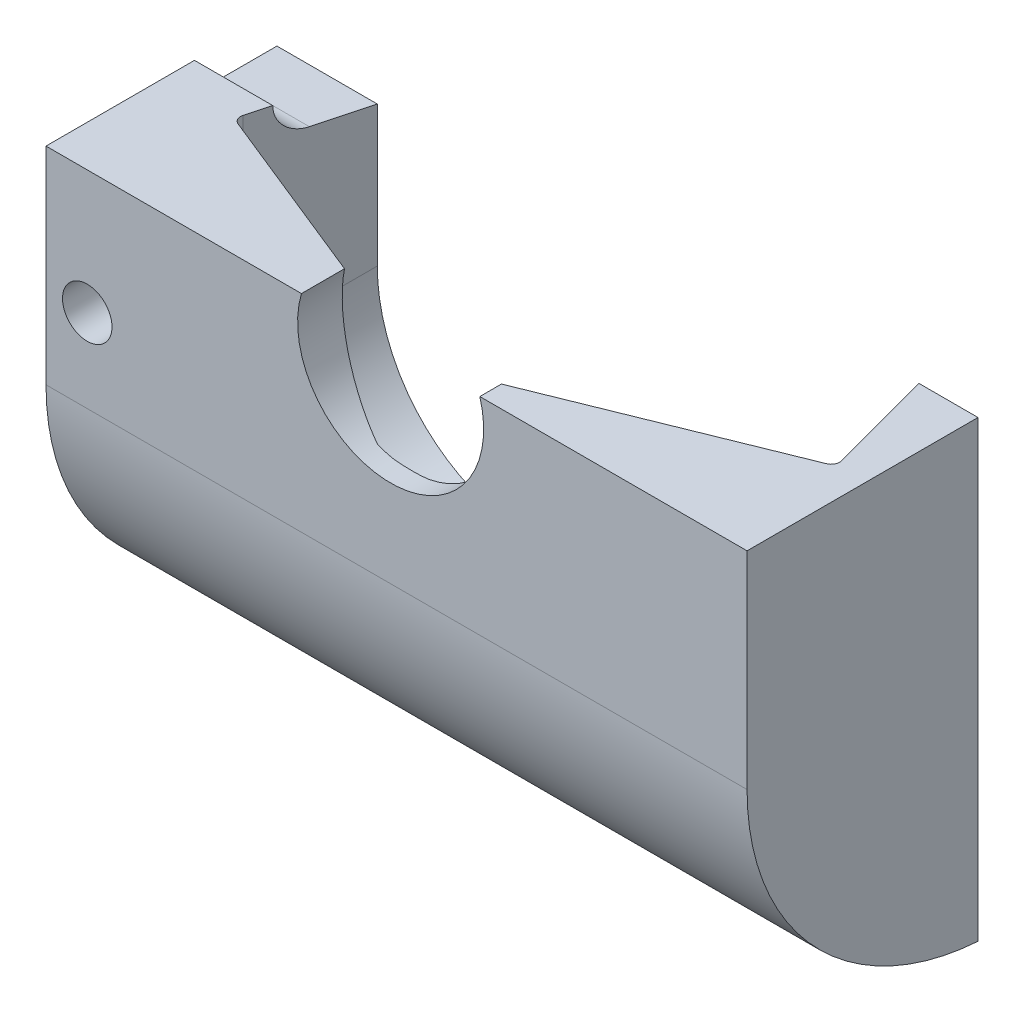
from build123d import *

# Parameters (mm, degrees)
SKETCH1_W           = 90
SKETCH1_H           = 110
BOSS_EXTRUDE1_DEPTH = 28
FILLET2_R           = 30
SKETCH3_R           = 1.5
CUT_EXTRUDE1_DEPTH  = 145.858551698
SKETCH4_R           = 3
CUT_EXTRUDE4_DEPTH  = 26
CUT_EXTRUDE5_START  = -13.7
SKETCH5_W           = 73
SKETCH5_H           = 87
CUT_EXTRUDE5_DEPTH  = 13.7
CUT_EXTRUDE5_TAPER  = 15
SKETCH8_W           = 73
SKETCH8_H           = 87
CUT_EXTRUDE8_DEPTH  = 11.8
CUT_EXTRUDE8_DRAFT  = -68
CUT_EXTRUDE9_START  = 30
SKETCH9_R           = 11.28
CUT_EXTRUDE9_DEPTH  = 61.8
FILLET19_R          = 20
SKETCH13_W          = 90
SKETCH13_H          = 55
CUT_EXTRUDE10_DEPTH = 145.858551855
CUT_EXTRUDE12_REACH = 111.128
SKETCH16_W          = 5
SKETCH16_H          = 55
CUT_EXTRUDE13_DEPTH = 110.128364941
FILLET20_R          = 1


with BuildPart() as part:
    # Sketch1 → Boss-Extrude1 (new body)
    with BuildSketch(Plane.XY):
        with Locations((45, 55)):
            Rectangle(SKETCH1_W, SKETCH1_H)
    extrude(amount=BOSS_EXTRUDE1_DEPTH)

    # Fillet2
    # the kernel refuses this fillet: 30 mm, written as the material it takes off along each edge
    with BuildSketch(Plane(origin=(-74.833147735, 0, 28), x_dir=(0, 0, -1), z_dir=(1, 0, 0)), Plane(origin=(164.833147735, 110, 28), x_dir=(0, 0, -1), z_dir=(-1, 0, 0))) as fillet2_piece_1:
        with BuildLine():
            CenterArc((30, 29.933259094), FILLET2_R, 180, 86.177446271)
            Line((0, 29.933259094), (-0.6, 29.933259094))
            Line((-0.6, 29.933259094), (-0.6, 0))
            Line((-0.6, 0), (0, -0.6))
            ThreePointArc((0, -0.6), (14, -0.6), (27.96, -0.598665182))
            Line((27.96, -0.598665182), (28, 0))
        make_face()
    extrude(amount=239.666295471, mode=Mode.SUBTRACT)

    # Sketch3 → Cut-Extrude1 (cut, through all)
    with BuildSketch(Plane(origin=(0, 0, 0), x_dir=(-1, 0, 0), z_dir=(0, 0, -1))):
        with Locations((-45, 105)):
            Circle(SKETCH3_R)
        with Locations((-45, 5)):
            Circle(SKETCH3_R)
        with Locations((-5, 70)):
            Circle(SKETCH3_R)
        with Locations((-5, 40)):
            Circle(SKETCH3_R)
    extrude(amount=-CUT_EXTRUDE1_DEPTH, mode=Mode.SUBTRACT)

    # Sketch4 → Cut-Extrude4 (cut)
    with BuildSketch(Plane.XY.offset(28)):
        with Locations((45, 105)):
            Circle(SKETCH4_R)
        with Locations((45, 5)):
            Circle(SKETCH4_R)
        with Locations((5, 70)):
            Circle(SKETCH4_R)
        with Locations((5, 40)):
            Circle(SKETCH4_R)
    extrude(amount=-CUT_EXTRUDE4_DEPTH, mode=Mode.SUBTRACT)

    # Sketch5 → Cut-Extrude5 (cut)
    with BuildSketch(Plane(origin=(0, 0, 0), x_dir=(-1, 0, 0), z_dir=(0, 0, -1)).offset(CUT_EXTRUDE5_START)):
        with Locations((-45, 55)):
            Rectangle(SKETCH5_W, SKETCH5_H)
    extrude(amount=CUT_EXTRUDE5_DEPTH, taper=CUT_EXTRUDE5_TAPER, mode=Mode.SUBTRACT)


with BuildPart() as cut_extrude8_tool:
    # Sketch8 → Cut-Extrude8 (with draft: the straight prism first)
    with BuildSketch(Plane(origin=(0, 0, 13.7), x_dir=(-1, 0, 0), z_dir=(0, 0, -1))):
        with Locations((-45, 55)):
            Rectangle(SKETCH8_W, SKETCH8_H)
    extrude(amount=-CUT_EXTRUDE8_DEPTH)
    # Cut-Extrude8: the draft: its side faces are tilted about the plane it starts from
    cut_extrude8_sides = [cut_extrude8_tool.faces().sort_by_distance(p)[0] for p in [
        (81.5, 55, 19.6),
        (45, 11.5, 19.6),
        (8.5, 55, 19.6),
        (45, 98.5, 19.6),
    ]]
    draft(cut_extrude8_sides, Plane(origin=(0, 0, 13.7), x_dir=(-1, 0, 0), z_dir=(0, 0, -1)), CUT_EXTRUDE8_DRAFT)


with BuildPart() as part_1:
    add(part.part)

    # Cut-Extrude8: cut by cut_extrude8_tool
    add(cut_extrude8_tool.part, mode=Mode.SUBTRACT)

    # Sketch9 → Cut-Extrude9 (cut)
    with BuildSketch(Plane(origin=(0, 0, 25.5), x_dir=(-1, 0, 0), z_dir=(0, 0, -1)).offset(CUT_EXTRUDE9_START)):
        with Locations((-41.78602487, 51.78602487)):
            Circle(SKETCH9_R)
    extrude(amount=-CUT_EXTRUDE9_DEPTH, mode=Mode.SUBTRACT)

    # Fillet19
    fillet19_edges = [part_1.edges().sort_by_distance(p)[0] for p in [
        (79.664548032, 96.664548032, 6.85),
        (79.664548032, 13.335451968, 6.85),
        (10.335451968, 13.335451968, 6.85),
        (10.335451968, 96.664548032, 6.85),
    ]]
    fillet(fillet19_edges, radius=FILLET19_R)

    # Sketch13 → Cut-Extrude10 (cut, through all)
    with BuildSketch(Plane(origin=(0, 0, 0), x_dir=(-1, 0, 0), z_dir=(0, 0, -1))):
        with Locations((-45, 82.5)):
            Rectangle(SKETCH13_W, SKETCH13_H)
    extrude(amount=-CUT_EXTRUDE10_DEPTH, mode=Mode.SUBTRACT)

    # Cut-Extrude12: up to this plane
    cut_extrude12_end = Plane(origin=(8.5, 11.5, 13.7), z_dir=(-0.9659258262890681, 0, -0.25881904510252135))
    # Sketch14 → Cut-Extrude12 (cut, up to the surface)
    with BuildSketch(Plane.ZY, mode=Mode.PRIVATE) as cut_extrude12_sk1:
        with BuildLine():
            Line((6.5, 58.5), (0, 58.5))
            Line((0, 58.5), (0, 51.5))
            Line((0, 51.5), (6.5, 51.5))
            ThreePointArc((6.5, 51.5), (10, 55), (6.5, 58.5))
        make_face()
    cut_extrude12_tool1 = split(extrude(cut_extrude12_sk1.sketch, amount=-CUT_EXTRUDE12_REACH, mode=Mode.PRIVATE), bisect_by=cut_extrude12_end, keep=Keep.BOTH, mode=Mode.PRIVATE)
    add(cut_extrude12_tool1.solids().sort_by_distance((0, 55, 4.657437))[0], mode=Mode.SUBTRACT)

    # Sketch16 → Cut-Extrude13 (cut, through all)
    with BuildSketch(Plane(origin=(0, 0, 0), x_dir=(-1, 0, 0), z_dir=(0, 0, -1))):
        with Locations((-87.5, 27.5)):
            Rectangle(SKETCH16_W, SKETCH16_H)
    extrude(amount=-CUT_EXTRUDE13_DEPTH, mode=Mode.SUBTRACT)

    # Fillet20
    fillet20_edges = [part_1.edges().sort_by_distance(p)[0] for p in [
        (45, 11.5, 13.7),
        (69.818765067, 12.807584264, 14.228298335),
        (20.181234933, 12.807584264, 14.228298335),
        (8.5, 42.909258263, 13.7),
        (9.807584264, 23.181234933, 14.228298335),
        (80.192415736, 23.181234933, 14.228298335),
        (81.5, 42.909258263, 13.7),
    ]]
    fillet(fillet20_edges, radius=FILLET20_R)


solid = part_1.part
